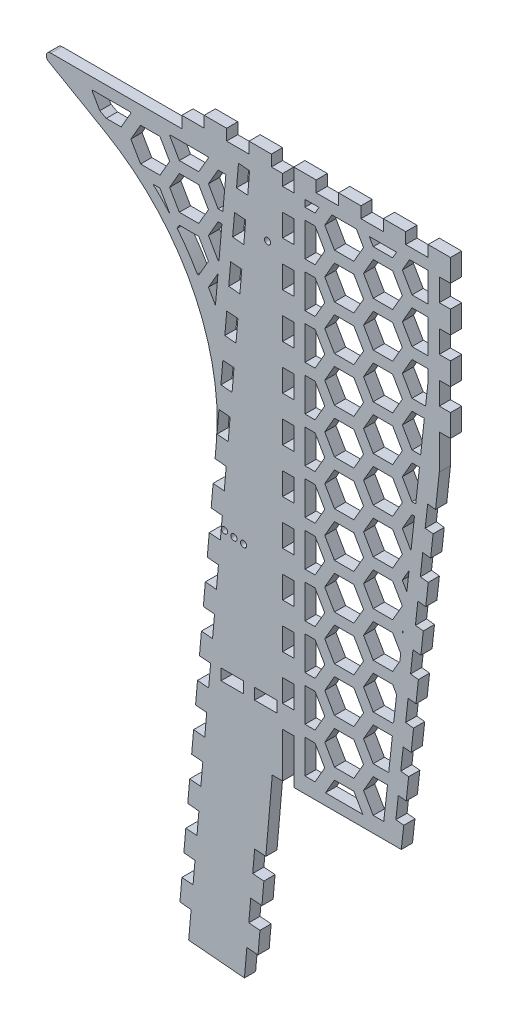
from build123d import *

# Parameters (mm, degrees)
SKETCH1_R             = 1.75
BOSS_EXTRUDE1_DEPTH   = 6.35
CUT_EXTRUDE1_DEPTH    = 338.903024913
SKETCH5_W             = 12.7
SKETCH5_H             = 6.35
CUT_EXTRUDE3_DEPTH    = 338.903024913
FILLET1_R             = 127
LPATTERN1_COUNT       = 10
LPATTERN1_PITCH       = 25.4
SKETCH6_W             = 6.35
SKETCH6_H             = 12.7
CUT_EXTRUDE4_DEPTH    = 338.903024913
CUT_EXTRUDE5_DEPTH    = 338.903024913
LPATTERN3_COUNT       = 7
LPATTERN3_PITCH       = 25.4
SKETCH10_W            = 6.35
SKETCH10_H            = 83.214016323
BOSS_EXTRUDE2_DEPTH   = 6.35
LPATTERN4_COUNT       = 4
LPATTERN4_PITCH       = 25.4
SKETCH11_W            = 6.35
SKETCH11_H            = 7.014016323
CUT_EXTRUDE7_DEPTH    = 338.903024913
SKETCH12_W            = 6.35
SKETCH12_H            = 12.7
CUT_EXTRUDE8_DEPTH    = 338.903024913
LPATTERN5_COUNT       = 12
LPATTERN5_PITCH       = 25.4
CUT_EXTRUDE9_DEPTH    = 338.903024913
LPATTERN6_COUNT       = 12
LPATTERN6_PITCH       = 25.4
SKETCH15_W            = 12.7
SKETCH15_H            = 6.35
CUT_EXTRUDE10_DEPTH   = 338.903024913
SKETCH16_W            = 6.35
SKETCH16_H            = 12.7
CUT_EXTRUDE11_DEPTH   = 338.903024913
BOSS_EXTRUDE3_DEPTH   = 6.35
BOSS_EXTRUDE3_2_DEPTH = 6.35
CUT_EXTRUDE13_DEPTH   = 338.903024913
FILL_PATTERN1_DEPTH   = 6.35
FILL_PATTERN1_2_DEPTH = 6.35
FILL_PATTERN1_3_DEPTH = 6.35
CUT_EXTRUDE14_DEPTH   = 6.35
SKETCH19_W            = 95.25
SKETCH19_H            = 12.954
CUT_EXTRUDE15_DEPTH   = 338.903024913
FILLET2_R             = 2.54
BOSS_EXTRUDE4_DEPTH   = 6.35
LPATTERN7_COUNT       = 5
LPATTERN7_PITCH       = 25.4
CUT_EXTRUDE17_DEPTH   = 338.903024913
LPATTERN8_COUNT       = 3
LPATTERN8_PITCH       = 25.4
CUT_EXTRUDE16_DEPTH   = 338.903024913


# Read off the part's stored shape, not the designer's step: Fill Pattern1
with BuildPart() as part:
    # Sketch1 → Boss-Extrude1 (new body)
    with BuildSketch(Plane.XY):
        Polygon((-101.927346492, 304.8), (-101.927346492, 298.45), (19.954542011, 228.081458863), (0, 0), (145.722653508, 0), (145.722653508, 304.8), align=None)
        with Locations((17.516544975, 106.665925891)):
            Circle(SKETCH1_R, mode=Mode.SUBTRACT)
        with Locations((22.915962626, 105.907087227)):
            Circle(SKETCH1_R, mode=Mode.SUBTRACT)
        with Locations((28.338574185, 105.337147786)):
            Circle(SKETCH1_R, mode=Mode.SUBTRACT)
        with Locations((41.953172759, 260.952721575)):
            Circle(SKETCH1_R, mode=Mode.SUBTRACT)
    extrude(amount=BOSS_EXTRUDE1_DEPTH)

    # Sketch2 → Cut-Extrude1 (cut, through all)
    with BuildSketch(Plane.XY.offset(6.35)):
        Polygon((145.722653508, 254), (117.824574416, 0), (145.722653508, 0), align=None)
    extrude(amount=-CUT_EXTRUDE1_DEPTH, mode=Mode.SUBTRACT)

    # Sketch5 → Cut-Extrude3 (cut, through all)
    with BuildSketch(Plane.XY.offset(6.35)):
        with Locations((126.672653508, 301.625)):
            Rectangle(SKETCH5_W, SKETCH5_H)
    cut_extrude3 = extrude(amount=-CUT_EXTRUDE3_DEPTH, mode=Mode.SUBTRACT)

    # Fillet1
    fillet1_edges = [part.edges().sort_by_distance(p)[0] for p in [
        (19.954542011, 228.081458863, 3.175),
    ]]
    fillet(fillet1_edges, radius=FILLET1_R)

    # LPattern1: Cut-Extrude3 ×10
    with Locations(*[(-i * LPATTERN1_PITCH, 0, 0) for i in range(1, LPATTERN1_COUNT)]):
        add(cut_extrude3, mode=Mode.SUBTRACT)

    # Sketch6 → Cut-Extrude4 (cut, through all)
    with BuildSketch(Plane.XY.offset(6.35)):
        with Locations((142.547653508, 285.75)):
            Rectangle(SKETCH6_W, SKETCH6_H)
    cut_extrude4 = extrude(amount=-CUT_EXTRUDE4_DEPTH, mode=Mode.SUBTRACT)

    # Sketch8 → Cut-Extrude5 (cut, through all)
    with BuildSketch(Plane.XY.offset(6.35)):
        Polygon((119.211139876, 12.624081599), (120.597705336, 25.248163198), (116.121058229, 25.739855541), (114.734492769, 13.115773942), align=None)
    cut_extrude5 = extrude(amount=-CUT_EXTRUDE5_DEPTH, mode=Mode.SUBTRACT)

    # LPattern3: Cut-Extrude5 ×7
    with Locations(*[Vector(0.10917838270172486, 0.9940221731685042, 0) * (i * LPATTERN3_PITCH) for i in range(1, LPATTERN3_COUNT)]):
        add(cut_extrude5, mode=Mode.SUBTRACT)

    # Sketch10 → Boss-Extrude2 (add, through all)
    with BuildSketch(Plane.XY.offset(6.35)):
        with Locations((142.547653508, 237.792991839)):
            Rectangle(SKETCH10_W, SKETCH10_H)
    extrude(amount=-BOSS_EXTRUDE2_DEPTH)

    # LPattern4: Cut-Extrude4 ×4
    with Locations(*[(0, -i * LPATTERN4_PITCH, 0) for i in range(1, LPATTERN4_COUNT)]):
        add(cut_extrude4, mode=Mode.SUBTRACT)

    # Sketch11 → Cut-Extrude7 (cut, through all)
    with BuildSketch(Plane.XY.offset(6.35)):
        with Locations((142.547653508, 199.692991839)):
            Rectangle(SKETCH11_W, SKETCH11_H)
    extrude(amount=-CUT_EXTRUDE7_DEPTH, mode=Mode.SUBTRACT)

    # Sketch12 → Cut-Extrude8 (cut, through all)
    with BuildSketch(Plane.XY.offset(6.35)):
        with Locations((53.647653508, 19.05)):
            Rectangle(SKETCH12_W, SKETCH12_H)
    cut_extrude8 = extrude(amount=-CUT_EXTRUDE8_DEPTH, mode=Mode.SUBTRACT)

    # LPattern5: Cut-Extrude8 ×12
    with Locations(*[(0, i * LPATTERN5_PITCH, 0) for i in range(1, LPATTERN5_COUNT)]):
        add(cut_extrude8, mode=Mode.SUBTRACT)

    # Sketch13 → Cut-Extrude9 (cut, through all)
    with BuildSketch(Plane.XY.offset(6.35)):
        Polygon((0, 0), (1.106877933, 12.651672666), (7.432714266, 12.098233699), (6.325836333, -0.553438966), align=None)
    cut_extrude9 = extrude(amount=-CUT_EXTRUDE9_DEPTH, mode=Mode.SUBTRACT)

    # LPattern6: Cut-Extrude9 ×12
    with Locations(*[Vector(0.08715574274766191, 0.9961946980917453, 0) * (i * LPATTERN6_PITCH) for i in range(1, LPATTERN6_COUNT)]):
        add(cut_extrude9, mode=Mode.SUBTRACT)

    # Sketch15 → Cut-Extrude10 (cut, through all)
    with BuildSketch(Plane.XY.offset(6.35)):
        with Locations((40.947653508, 34.925)):
            Rectangle(SKETCH15_W, SKETCH15_H)
        with Locations((21.897653508, 34.925)):
            Rectangle(SKETCH15_W, SKETCH15_H)
    extrude(amount=-CUT_EXTRUDE10_DEPTH, mode=Mode.SUBTRACT)

    # Sketch16 → Cut-Extrude11 (cut, through all)
    with BuildSketch(Plane.XY.offset(6.35)):
        with Locations((53.647653508, 6.35)):
            Rectangle(SKETCH16_W, SKETCH16_H)
    extrude(amount=-CUT_EXTRUDE11_DEPTH, mode=Mode.SUBTRACT)

    # Sketch17<2> → Cut-Extrude14 (cut)
    with BuildSketch(Plane.XY.offset(6.35)):
        Polygon((63.172653508, 292.1), (63.172653508, 6.35), (107.6031868, 6.35), (133.022653508, 237.783301283), (133.022653508, 292.1), align=None)
        with BuildLine():
            Line((-72.785048673, 285.496), (18.603407514, 285.496))
            Line((18.603407514, 285.496), (11.527224146, 204.614854001))
            ThreePointArc((11.527224146, 204.614854001), (-21.299489042, 254.780621497), (-72.785048673, 285.496))
        make_face()
    extrude(amount=-CUT_EXTRUDE14_DEPTH, mode=Mode.SUBTRACT)


with BuildPart() as body_2:
    # Sketch17 → Boss-Extrude3 (new body)
    with BuildSketch(Plane.XY.offset(6.35)):
        Polygon((63.172653508, 292.1), (63.172653508, 6.35), (107.6031868, 6.35), (133.022653508, 237.783301283), (133.022653508, 292.1), align=None)
    extrude(amount=-BOSS_EXTRUDE3_DEPTH)

    # Sketch18 → Cut-Extrude13 (cut, through all)
    with BuildSketch(Plane.XY.offset(6.35)):
        Polygon((90.896914822, 269.152568372), (79.898392194, 269.152568372), (74.39913088, 259.627568372), (79.898392194, 250.102568372), (90.896914822, 250.102568372), (96.396176136, 259.627568372), align=None)
    extrude(amount=-CUT_EXTRUDE13_DEPTH, mode=Mode.SUBTRACT)

    # Fill Pattern1 3 outline → Fill Pattern1 3 (cut)
    with BuildSketch(Plane.XY):
        Polygon((112.893960078, 212.002568372), (118.393221392, 221.527568372), (112.893960078, 231.052568372), (101.89543745, 231.052568372), (96.396176136, 221.527568372), (101.89543745, 212.002568372), align=None)
        Polygon((101.89543745, 288.202568372), (112.893960078, 288.202568372), (115.144143278, 292.1), (99.64525425, 292.1), align=None)
        Polygon((133.022653508, 292.1), (122.476491696, 292.1), (118.393221392, 285.027568372), (123.892482706, 275.502568372), (133.022653508, 275.502568372), align=None)
        Polygon((96.396176136, 285.027568372), (92.312905831, 292.1), (78.482401184, 292.1), (74.39913088, 285.027568372), (79.898392194, 275.502568372), (90.896914822, 275.502568372), align=None)
        Polygon((133.022653508, 250.102568372), (133.022653508, 269.152568372), (123.892482706, 269.152568372), (118.393221392, 259.627568372), (123.892482706, 250.102568372), align=None)
        Polygon((68.899869566, 288.202568372), (71.150052765, 292.1), (63.172653508, 292.1), (63.172653508, 288.202568372), align=None)
        Polygon((133.022653508, 237.783301283), (133.022653508, 243.752568372), (123.892482706, 243.752568372), (118.393221392, 234.227568372), (123.892482706, 224.702568372), (131.58593177, 224.702568372), align=None)
        Polygon((68.899869566, 281.852568372), (63.172653508, 281.852568372), (63.172653508, 262.802568372), (68.899869566, 262.802568372), (74.39913088, 272.327568372), align=None)
        Polygon((128.796123861, 199.302568372), (130.888479793, 218.352568372), (123.892482706, 218.352568372), (118.393221392, 208.827568372), (123.892482706, 199.302568372), align=None)
        Polygon((68.899869566, 256.452568372), (63.172653508, 256.452568372), (63.172653508, 237.402568372), (68.899869566, 237.402568372), (74.39913088, 246.927568372), align=None)
        Polygon((126.006315952, 173.902568372), (128.098671884, 192.952568372), (123.892482706, 192.952568372), (118.393221392, 183.427568372), (123.892482706, 173.902568372), align=None)
        Polygon((68.899869566, 231.052568372), (63.172653508, 231.052568372), (63.172653508, 212.002568372), (68.899869566, 212.002568372), (74.39913088, 221.527568372), align=None)
        Polygon((123.32455118, 149.486254629), (125.308863975, 167.552568372), (123.892482706, 167.552568372), (118.393221392, 158.027568372), align=None)
        Polygon((68.899869566, 205.652568372), (63.172653508, 205.652568372), (63.172653508, 186.602568372), (68.899869566, 186.602568372), (74.39913088, 196.127568372), align=None)
        Polygon((120.980646967, 128.146015815), (122.196392289, 139.214853595), (118.393221392, 132.627568372), align=None)
        Polygon((68.899869566, 180.252568372), (63.172653508, 180.252568372), (63.172653508, 161.202568372), (68.899869566, 161.202568372), (74.39913088, 170.727568372), align=None)
        Polygon((118.636742753, 106.805777001), (118.751165351, 107.847545495), (118.393221392, 107.227568372), align=None)
        Polygon((68.899869566, 154.852568372), (63.172653508, 154.852568372), (63.172653508, 135.802568372), (68.899869566, 135.802568372), (74.39913088, 145.327568372), align=None)
        Polygon((117.028551882, 92.163891445), (117.464790646, 96.135657594), (112.893960078, 104.052568372), (101.89543745, 104.052568372), (96.396176136, 94.527568372), (101.89543745, 85.002568372), (112.893960078, 85.002568372), align=None)
        Polygon((68.899869566, 129.452568372), (63.172653508, 129.452568372), (63.172653508, 110.402568372), (68.899869566, 110.402568372), (74.39913088, 119.927568372), align=None)
        Polygon((113.583324943, 60.796583344), (115.120886433, 74.795418781), (112.893960078, 78.652568372), (101.89543745, 78.652568372), (96.396176136, 69.127568372), (101.89543745, 59.602568372), (112.893960078, 59.602568372), align=None)
        Polygon((68.899869566, 104.052568372), (63.172653508, 104.052568372), (63.172653508, 85.002568372), (68.899869566, 85.002568372), (74.39913088, 94.527568372), align=None)
        Polygon((110.662372451, 34.202568372), (112.754728383, 53.252568372), (101.89543745, 53.252568372), (96.396176136, 43.727568372), (101.89543745, 34.202568372), align=None)
        Polygon((68.899869566, 78.652568372), (63.172653508, 78.652568372), (63.172653508, 59.602568372), (68.899869566, 59.602568372), (74.39913088, 69.127568372), align=None)
        Polygon((107.872564542, 8.802568372), (109.964920474, 27.852568372), (101.89543745, 27.852568372), (96.396176136, 18.327568372), (101.89543745, 8.802568372), align=None)
        Polygon((68.899869566, 53.252568372), (63.172653508, 53.252568372), (63.172653508, 34.202568372), (68.899869566, 34.202568372), (74.39913088, 43.727568372), align=None)
        Polygon((68.899869566, 27.852568372), (63.172653508, 27.852568372), (63.172653508, 8.802568372), (68.899869566, 8.802568372), (74.39913088, 18.327568372), align=None)
        Polygon((74.816226975, 6.35), (95.979080041, 6.35), (90.896914822, 15.152568372), (79.898392194, 15.152568372), align=None)
        Polygon((112.893960078, 256.452568372), (101.89543745, 256.452568372), (96.396176136, 246.927568372), (101.89543745, 237.402568372), (112.893960078, 237.402568372), (118.393221392, 246.927568372), align=None)
        Polygon((90.896914822, 218.352568372), (79.898392194, 218.352568372), (74.39913088, 208.827568372), (79.898392194, 199.302568372), (90.896914822, 199.302568372), (96.396176136, 208.827568372), align=None)
        Polygon((112.893960078, 262.802568372), (118.393221392, 272.327568372), (112.893960078, 281.852568372), (101.89543745, 281.852568372), (96.396176136, 272.327568372), (101.89543745, 262.802568372), align=None)
        Polygon((79.898392194, 224.702568372), (90.896914822, 224.702568372), (96.396176136, 234.227568372), (90.896914822, 243.752568372), (79.898392194, 243.752568372), (74.39913088, 234.227568372), align=None)
        Polygon((90.896914822, 192.952568372), (79.898392194, 192.952568372), (74.39913088, 183.427568372), (79.898392194, 173.902568372), (90.896914822, 173.902568372), (96.396176136, 183.427568372), align=None)
        Polygon((112.893960078, 186.602568372), (118.393221392, 196.127568372), (112.893960078, 205.652568372), (101.89543745, 205.652568372), (96.396176136, 196.127568372), (101.89543745, 186.602568372), align=None)
        Polygon((90.896914822, 167.552568372), (79.898392194, 167.552568372), (74.39913088, 158.027568372), (79.898392194, 148.502568372), (90.896914822, 148.502568372), (96.396176136, 158.027568372), align=None)
        Polygon((112.893960078, 161.202568372), (118.393221392, 170.727568372), (112.893960078, 180.252568372), (101.89543745, 180.252568372), (96.396176136, 170.727568372), (101.89543745, 161.202568372), align=None)
        Polygon((90.896914822, 142.152568372), (79.898392194, 142.152568372), (74.39913088, 132.627568372), (79.898392194, 123.102568372), (90.896914822, 123.102568372), (96.396176136, 132.627568372), align=None)
        Polygon((112.893960078, 135.802568372), (118.393221392, 145.327568372), (112.893960078, 154.852568372), (101.89543745, 154.852568372), (96.396176136, 145.327568372), (101.89543745, 135.802568372), align=None)
        Polygon((90.896914822, 116.752568372), (79.898392194, 116.752568372), (74.39913088, 107.227568372), (79.898392194, 97.702568372), (90.896914822, 97.702568372), (96.396176136, 107.227568372), align=None)
        Polygon((112.893960078, 110.402568372), (118.393221392, 119.927568372), (112.893960078, 129.452568372), (101.89543745, 129.452568372), (96.396176136, 119.927568372), (101.89543745, 110.402568372), align=None)
        Polygon((90.896914822, 91.352568372), (79.898392194, 91.352568372), (74.39913088, 81.827568372), (79.898392194, 72.302568372), (90.896914822, 72.302568372), (96.396176136, 81.827568372), align=None)
        Polygon((90.896914822, 65.952568372), (79.898392194, 65.952568372), (74.39913088, 56.427568372), (79.898392194, 46.902568372), (90.896914822, 46.902568372), (96.396176136, 56.427568372), align=None)
        Polygon((90.896914822, 40.552568372), (79.898392194, 40.552568372), (74.39913088, 31.027568372), (79.898392194, 21.502568372), (90.896914822, 21.502568372), (96.396176136, 31.027568372), align=None)
    extrude(amount=FILL_PATTERN1_3_DEPTH, mode=Mode.SUBTRACT)


with BuildPart() as body_3:
    # Sketch17 → Boss-Extrude3 2 (new body)
    with BuildSketch(Plane.XY.offset(6.35)):
        with BuildLine():
            Line((-72.785048673, 285.496), (18.603407514, 285.496))
            Line((18.603407514, 285.496), (11.527224146, 204.614854001))
            ThreePointArc((11.527224146, 204.614854001), (-21.299489042, 254.780621497), (-72.785048673, 285.496))
        make_face()
    extrude(amount=-BOSS_EXTRUDE3_2_DEPTH)

    # Fill Pattern1 outline → Fill Pattern1 (cut)
    with BuildSketch(Plane.XY):
        Polygon((2.908733797, 275.502568372), (8.407995111, 285.027568372), (8.137545985, 285.496), (-13.318601018, 285.496), (-13.589050145, 285.027568372), (-8.089788831, 275.502568372), align=None)
        Polygon((16.61798951, 262.802568372), (18.28464855, 281.852568372), (13.907256425, 281.852568372), (8.407995111, 272.327568372), (13.907256425, 262.802568372), align=None)
        with BuildLine():
            Line((-35.586095401, 285.027568372), (-35.856544528, 285.496))
            Line((-35.856544528, 285.496), (-72.785048673, 285.496))
            ThreePointArc((-72.785048673, 285.496), (-60.92926885, 281.051481218), (-49.548459184, 275.502568372))
            Line((-49.548459184, 275.502568372), (-41.085356715, 275.502568372))
            Line((-41.085356715, 275.502568372), (-35.586095401, 285.027568372))
        make_face()
        Polygon((14.395777456, 237.402568372), (16.062436497, 256.452568372), (13.907256425, 256.452568372), (8.407995111, 246.927568372), (13.907256425, 237.402568372), align=None)
        with BuildLine():
            Line((-19.088311459, 256.452568372), (-23.074569899, 256.452568372))
            ThreePointArc((-23.074569899, 256.452568372), (-18.242851535, 251.752176415), (-13.654835959, 246.813623999))
            Line((-13.654835959, 246.813623999), (-13.589050145, 246.927568372))
            Line((-13.589050145, 246.927568372), (-19.088311459, 256.452568372))
        make_face()
        Polygon((12.401708346, 214.61025414), (13.828252616, 230.915729759), (8.407995111, 221.527568372), align=None)
        with BuildLine():
            Line((-8.089788831, 243.752568372), (-9.311654444, 241.636235049))
            ThreePointArc((-9.311654444, 241.636235049), (-3.245145983, 233.389944793), (2.170878279, 224.702568372))
            Line((2.170878279, 224.702568372), (2.908733797, 224.702568372))
            Line((2.908733797, 224.702568372), (8.407995111, 234.227568372))
            Line((8.407995111, 234.227568372), (2.908733797, 243.752568372))
            Line((2.908733797, 243.752568372), (-8.089788831, 243.752568372))
        make_face()
        Polygon((-35.586095401, 272.327568372), (-30.086834087, 262.802568372), (-19.088311459, 262.802568372), (-13.589050145, 272.327568372), (-19.088311459, 281.852568372), (-30.086834087, 281.852568372), align=None)
        Polygon((2.908733797, 250.102568372), (8.407995111, 259.627568372), (2.908733797, 269.152568372), (-8.089788831, 269.152568372), (-13.589050145, 259.627568372), (-8.089788831, 250.102568372), align=None)
    extrude(amount=FILL_PATTERN1_DEPTH, mode=Mode.SUBTRACT)


with BuildPart() as body_4:
    # Fill Pattern1 2 outline → Fill Pattern1 2 (new body)
    with BuildSketch(Plane.XY):
        with BuildLine():
            Line((-57.583140657, 285.027568372), (-57.31269153, 285.496))
            Line((-57.31269153, 285.496), (-72.785048673, 285.496))
            ThreePointArc((-72.785048673, 285.496), (-62.829669453, 281.851439661), (-53.195270766, 277.427554784))
            Line((-53.195270766, 277.427554784), (-57.583140657, 285.027568372))
        make_face()
    extrude(amount=FILL_PATTERN1_2_DEPTH)


with BuildPart() as body_2_1:
    add(body_2.part)

    # Combine1: union part, body 4, body 3
    add(part.part)
    add(body_4.part)
    add(body_3.part)

    # Sketch19 → Cut-Extrude15 (cut, through all)
    with BuildSketch(Plane.XY.offset(6.35)):
        with Locations((-54.302346492, 298.323)):
            Rectangle(SKETCH19_W, SKETCH19_H)
    extrude(amount=-CUT_EXTRUDE15_DEPTH, mode=Mode.SUBTRACT)

    # Fillet2
    fillet2_edges = [body_2_1.edges().sort_by_distance(p)[0] for p in [
        (-90.488882959, 291.846, 3.175),
    ]]
    fillet(fillet2_edges, radius=FILLET2_R)

    # Sketch20 → Boss-Extrude4 (add)
    with BuildSketch(Plane.XY.offset(6.35)):
        Polygon((0.338937449, 3.874072765), (44.619791779, 0), (35.157058037, -108.159541598), (-9.123796293, -104.285468833), align=None)
    extrude(amount=-BOSS_EXTRUDE4_DEPTH)

    # LPattern7: Cut-Extrude9 ×5
    with Locations(*[Vector(-0.08715574274766177, -0.9961946980917453, 0) * (i * LPATTERN7_PITCH) for i in range(1, LPATTERN7_COUNT)]):
        add(cut_extrude9, mode=Mode.SUBTRACT)

    # Sketch22 → Cut-Extrude17 (cut, through all)
    with BuildSketch(Plane.XY.offset(6.35)):
        Polygon((36.5327088, -92.435781425), (35.425830867, -105.087454091), (29.099994534, -104.534015125), (30.206872467, -91.882342459), align=None)
    cut_extrude17 = extrude(amount=-CUT_EXTRUDE17_DEPTH, mode=Mode.SUBTRACT)

    # LPattern8: Cut-Extrude17 ×3
    with Locations(*[Vector(0.08715574274766164, 0.9961946980917453, 0) * (i * LPATTERN8_PITCH) for i in range(1, LPATTERN8_COUNT)]):
        add(cut_extrude17, mode=Mode.SUBTRACT)

    # Sketch21 → Cut-Extrude16 (cut, through all)
    with BuildSketch(Plane.XY.offset(6.35)):
        Polygon((7.432714266, 12.098233699), (1.106877933, 12.651672666), (0, 0), (6.325836333, -0.553438966), align=None)
        Polygon((-2.52918713, -101.766820293), (-8.855023463, -101.213381326), (-9.123796293, -104.285468833), (-2.79795996, -104.838907799), align=None)
        Polygon((29.099994534, -104.534015125), (35.425830867, -105.087454091), (35.157058037, -108.159541598), (28.831221704, -107.606102631), align=None)
    extrude(amount=-CUT_EXTRUDE16_DEPTH, mode=Mode.SUBTRACT)


solid = body_2_1.part
